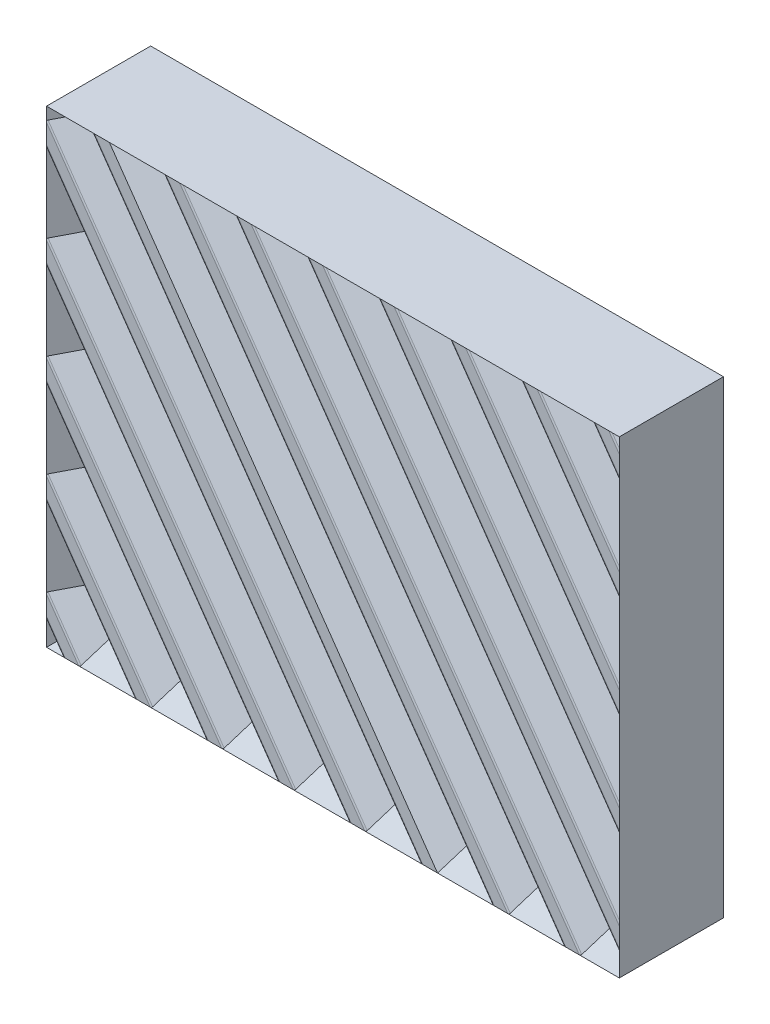
from build123d import *

# Parameters (mm, degrees)
SKETCH1_W           = 44
SKETCH1_H           = 36
BOSS_EXTRUDE1_DEPTH = 8
SKETCH2_W           = 40
SKETCH2_H           = 32
CUT_EXTRUDE1_DEPTH  = 2
CHAMFER2_SIZE       = 2
CUT_EXTRUDE2_DEPTH  = 5
BOSS_EXTRUDE2_START = -60
BOSS_EXTRUDE2_DEPTH = 80
LPATTERN1_COUNT     = 13
LPATTERN1_PITCH     = 4.5
SKETCH5_OUTSIDE_W   = 122.041
SKETCH5_OUTSIDE_H   = 127.588
SKETCH5_OUTSIDE_W_2 = 44
SKETCH5_OUTSIDE_H_2 = 36
CUT_EXTRUDE3_DEPTH  = 76.5546925
FILLET2_R           = 0.2


# Some blends are built 0.0001 mm under size
with BuildPart() as part:
    # Sketch1 → Boss-Extrude1 (new body)
    with BuildSketch(Plane.XY):
        Rectangle(SKETCH1_W, SKETCH1_H)
    extrude(amount=BOSS_EXTRUDE1_DEPTH)

    # Sketch2 → Cut-Extrude1 (cut)
    with BuildSketch(Plane.XY.offset(8)):
        Rectangle(SKETCH2_W, SKETCH2_H)
    extrude(amount=-CUT_EXTRUDE1_DEPTH, mode=Mode.SUBTRACT)

    # Chamfer2
    chamfer2_edges = [part.edges().sort_by_distance(p)[0] for p in [
        (0, -16, 8),
        (20, 0, 8),
        (0, 16, 8),
        (-20, 0, 8),
    ]]
    chamfer(chamfer2_edges, length=CHAMFER2_SIZE - 0.0001)  # a hair under: the kernel refuses the full size

    # Sketch3 → Cut-Extrude2 (cut)
    with BuildSketch(Plane.XY.offset(6)):
        with BuildLine():
            ThreePointArc((12, -16), (17.88854382, -8.94427191), (20, 0))
            ThreePointArc((20, 0), (17.88854382, 8.94427191), (12, 16))
            Line((12, 16), (-12, 16))
            ThreePointArc((-12, 16), (-20, 0), (-12, -16))
            Line((-12, -16), (12, -16))
        make_face()
    extrude(amount=-CUT_EXTRUDE2_DEPTH, mode=Mode.SUBTRACT)

    # Sketch4 → Boss-Extrude2 (add)
    with BuildSketch(Plane(origin=(15.69501201, -22.414800119, 0), x_dir=(0, 0, -1), z_dir=(0.5735764363510444, -0.819152044288993, 0)).offset(BOSS_EXTRUDE2_START)):
        Polygon((-8, 27.759934391), (-8, 26.345720829), (-6, 28.345720829), (-6, 29.759934391), align=None)
    boss_extrude2 = extrude(amount=BOSS_EXTRUDE2_DEPTH)

    # LPattern1: Boss-Extrude2 ×13
    with Locations(*[Vector(-0.8191520442889939, -0.5735764363510432, 0) * (i * LPATTERN1_PITCH) for i in range(1, LPATTERN1_COUNT)]):
        add(boss_extrude2)

    # Sketch5 outside → Cut-Extrude3 (cut, through all)
    with BuildSketch(Plane(origin=(0, 0, 0), x_dir=(-1, 0, 0), z_dir=(0, 0, -1))):
        with Locations((-5.0855, -5.428)):
            Rectangle(SKETCH5_OUTSIDE_W, SKETCH5_OUTSIDE_H)
        Rectangle(SKETCH5_OUTSIDE_W_2, SKETCH5_OUTSIDE_H_2, mode=Mode.SUBTRACT)
    extrude(amount=-CUT_EXTRUDE3_DEPTH, mode=Mode.SUBTRACT)

    # Fillet2
    # the kernel refuses this fillet: 0.2 mm, written as the material it takes off along each edge
    with BuildSketch(Plane(origin=(10.179193955, 18.169551943, 8), x_dir=(-0.819152044288993, -0.5735764363510443, 0), z_dir=(0.5735764363510444, -0.819152044288993, 0))) as fillet2_piece_1_section:
        with BuildLine():
            CenterArc((FILLET2_R * 0.414213562373, FILLET2_R), FILLET2_R, 225, 45)
            Line((-FILLET2_R * 0.292893218813, FILLET2_R * 0.292893218813), (0, 0))
            Line((0, 0), (FILLET2_R * 0.414213562373, 0))
        make_face()
    fillet2_piece_1 = extrude(amount=20.815878857, mode=Mode.PRIVATE)
    fillet2_piece_1 = split(fillet2_piece_1, bisect_by=Plane(origin=(19.065977796, 9.642017265, 5.066077796), z_dir=(-0.7071067811865476, 0, 0.7071067811865476)), keep=Keep.TOP, mode=Mode.PRIVATE)
    fillet2_piece_1 = split(fillet2_piece_1, bisect_by=Plane(origin=(16.144051286, 13.814960786, 3.815060786), z_dir=(0, -0.7071067811865476, 0.7071067811865476)), keep=Keep.TOP, mode=Mode.PRIVATE)
    add(fillet2_piece_1, mode=Mode.SUBTRACT)
    with BuildSketch(Plane(origin=(7.879181539, 18.988703987, 8), x_dir=(0.819152044288993, 0.5735764363510443, 0), z_dir=(0.5735764363510444, -0.819152044288993, 0))) as fillet2_piece_2_section:
        with BuildLine():
            CenterArc((FILLET2_R * 2.41421356237, -FILLET2_R), FILLET2_R, 90, 135)
            Line((FILLET2_R * 1.70710678119, -FILLET2_R * 1.70710678119), (0, 0))
            Line((0, 0), (FILLET2_R * 2.41421356237, 0))
        make_face()
    fillet2_piece_2 = extrude(amount=25.825828135, mode=Mode.PRIVATE)
    fillet2_piece_2 = split(fillet2_piece_2, bisect_by=Plane(origin=(18.657379371, 8.616293188, 4.657479371), z_dir=(-0.7071067811865476, 0, 0.7071067811865476)), keep=Keep.TOP, mode=Mode.PRIVATE)
    fillet2_piece_2 = split(fillet2_piece_2, bisect_by=Plane(origin=(15.403002839, 13.264024546, 3.264124546), z_dir=(0, -0.7071067811865476, 0.7071067811865476)), keep=Keep.TOP, mode=Mode.PRIVATE)
    add(fillet2_piece_2, mode=Mode.SUBTRACT)
    with BuildSketch(Plane(origin=(4.685708305, 18.169551943, 8), x_dir=(-0.819152044288993, -0.5735764363510444, 0), z_dir=(0.5735764363510444, -0.819152044288993, 0))) as fillet2_piece_3_section:
        with BuildLine():
            CenterArc((FILLET2_R * 0.414213562373, FILLET2_R), FILLET2_R, 225, 45)
            Line((-FILLET2_R * 0.292893218813, FILLET2_R * 0.292893218813), (0, 0))
            Line((0, 0), (FILLET2_R * 0.414213562373, 0))
        make_face()
    fillet2_piece_3 = extrude(amount=30.39347881, mode=Mode.PRIVATE)
    fillet2_piece_3 = split(fillet2_piece_3, bisect_by=Plane(origin=(17.692607678, 5.71928784, 3.692707678), z_dir=(-0.7071067811865476, 0, 0.7071067811865476)), keep=Keep.TOP, mode=Mode.PRIVATE)
    fillet2_piece_3 = split(fillet2_piece_3, bisect_by=Plane(origin=(13.397322992, 11.853590102, 1.853690102), z_dir=(0, -0.7071067811865476, 0.7071067811865476)), keep=Keep.TOP, mode=Mode.PRIVATE)
    add(fillet2_piece_3, mode=Mode.SUBTRACT)
    with BuildSketch(Plane(origin=(2.385695889, 18.988703987, 8), x_dir=(0.819152044288993, 0.5735764363510444, 0), z_dir=(0.5735764363510444, -0.819152044288993, 0))) as fillet2_piece_4_section:
        with BuildLine():
            CenterArc((FILLET2_R * 2.41421356237, -FILLET2_R), FILLET2_R, 90, 135)
            Line((FILLET2_R * 1.70710678119, -FILLET2_R * 1.70710678119), (0, 0))
            Line((0, 0), (FILLET2_R * 2.41421356237, 0))
        make_face()
    fillet2_piece_4 = extrude(amount=35.403428087, mode=Mode.PRIVATE)
    fillet2_piece_4 = split(fillet2_piece_4, bisect_by=Plane(origin=(17.283953351, 4.693778412, 3.284053351), z_dir=(-0.7071067811865476, 0, 0.7071067811865476)), keep=Keep.TOP, mode=Mode.PRIVATE)
    fillet2_piece_4 = split(fillet2_piece_4, bisect_by=Plane(origin=(12.656364391, 11.302660362, 1.302760362), z_dir=(0, -0.7071067811865476, 0.7071067811865476)), keep=Keep.TOP, mode=Mode.PRIVATE)
    add(fillet2_piece_4, mode=Mode.SUBTRACT)
    with BuildSketch(Plane(origin=(-0.807777344, 18.169551943, 8), x_dir=(-0.819152044288993, -0.5735764363510444, 0), z_dir=(0.5735764363510444, -0.819152044288993, 0))) as fillet2_piece_5_section:
        with BuildLine():
            CenterArc((FILLET2_R * 0.414213562373, FILLET2_R), FILLET2_R, 225, 45)
            Line((-FILLET2_R * 0.292893218813, FILLET2_R * 0.292893218813), (0, 0))
            Line((0, 0), (FILLET2_R * 0.414213562373, 0))
        make_face()
    fillet2_piece_5 = extrude(amount=39.971078762, mode=Mode.PRIVATE)
    fillet2_piece_5 = split(fillet2_piece_5, bisect_by=Plane(origin=(16.319236933, 1.796545882, 2.319336933), z_dir=(-0.7071067811865476, 0, 0.7071067811865476)), keep=Keep.TOP, mode=Mode.PRIVATE)
    fillet2_piece_5 = split(fillet2_piece_5, bisect_by=Plane(origin=(10.650587657, 9.892216045, -0.107683955), z_dir=(0, -0.7071067811865476, 0.7071067811865476)), keep=Keep.TOP, mode=Mode.PRIVATE)
    add(fillet2_piece_5, mode=Mode.SUBTRACT)
    with BuildSketch(Plane(origin=(-3.10778976, 18.988703987, 8), x_dir=(0.819152044288993, 0.5735764363510444, 0), z_dir=(0.5735764363510444, -0.819152044288993, 0))) as fillet2_piece_6_section:
        with BuildLine():
            CenterArc((FILLET2_R * 2.41421356237, -FILLET2_R), FILLET2_R, 90, 135)
            Line((FILLET2_R * 1.70710678119, -FILLET2_R * 1.70710678119), (0, 0))
            Line((0, 0), (FILLET2_R * 2.41421356237, 0))
        make_face()
    fillet2_piece_6 = extrude(amount=44.981028039, mode=Mode.PRIVATE)
    fillet2_piece_6 = split(fillet2_piece_6, bisect_by=Plane(origin=(15.910552327, 0.771153542, 1.910652327), z_dir=(-0.7071067811865476, 0, 0.7071067811865476)), keep=Keep.TOP, mode=Mode.PRIVATE)
    fillet2_piece_6 = split(fillet2_piece_6, bisect_by=Plane(origin=(9.909678165, 9.341290016, -0.658609984), z_dir=(0, -0.7071067811865476, 0.7071067811865476)), keep=Keep.TOP, mode=Mode.PRIVATE)
    add(fillet2_piece_6, mode=Mode.SUBTRACT)
    with BuildSketch(Plane(origin=(-6.301262993, 18.169551943, 8), x_dir=(-0.819152044288993, -0.5735764363510444, 0), z_dir=(0.5735764363510444, -0.819152044288993, 0))) as fillet2_piece_7_section:
        with BuildLine():
            CenterArc((FILLET2_R * 0.414213562373, FILLET2_R), FILLET2_R, 225, 45)
            Line((-FILLET2_R * 0.292893218813, FILLET2_R * 0.292893218813), (0, 0))
            Line((0, 0), (FILLET2_R * 0.414213562373, 0))
        make_face()
    fillet2_piece_7 = extrude(amount=44.361854603, mode=Mode.PRIVATE)
    fillet2_piece_7 = split(fillet2_piece_7, bisect_by=Plane(origin=(6.415095796, -8.993936556, -1.005963444), z_dir=(0, 0.7071067811865476, 0.7071067811865476)), keep=Keep.TOP, mode=Mode.PRIVATE)
    fillet2_piece_7 = split(fillet2_piece_7, bisect_by=Plane(origin=(6.415095796, 8.993936558, -1.005963442), z_dir=(0, -0.7071067811865476, 0.7071067811865476)), keep=Keep.TOP, mode=Mode.PRIVATE)
    add(fillet2_piece_7, mode=Mode.SUBTRACT)
    with BuildSketch(Plane(origin=(-8.60127541, 18.988703987, 8), x_dir=(0.819152044288993, 0.5735764363510444, 0), z_dir=(0.5735764363510444, -0.819152044288993, 0))) as fillet2_piece_8_section:
        with BuildLine():
            CenterArc((FILLET2_R * 2.41421356237, -FILLET2_R), FILLET2_R, 90, 135)
            Line((FILLET2_R * 1.70710678119, -FILLET2_R * 1.70710678119), (0, 0))
            Line((0, 0), (FILLET2_R * 2.41421356237, 0))
        make_face()
    fillet2_piece_8 = extrude(amount=46.361854603, mode=Mode.PRIVATE)
    fillet2_piece_8 = split(fillet2_piece_8, bisect_by=Plane(origin=(4.956594257, -8.95565305, -1.04424695), z_dir=(0, 0.7071067811865476, 0.7071067811865476)), keep=Keep.TOP, mode=Mode.PRIVATE)
    fillet2_piece_8 = split(fillet2_piece_8, bisect_by=Plane(origin=(4.956594257, 8.95565305, -1.04424695), z_dir=(0, -0.7071067811865476, 0.7071067811865476)), keep=Keep.TOP, mode=Mode.PRIVATE)
    add(fillet2_piece_8, mode=Mode.SUBTRACT)
    with BuildSketch(Plane(origin=(-11.794748643, 18.169551943, 8), x_dir=(-0.819152044288993, -0.5735764363510443, 0), z_dir=(0.5735764363510444, -0.819152044288993, 0))) as fillet2_piece_9_section:
        with BuildLine():
            CenterArc((FILLET2_R * 0.414213562373, FILLET2_R), FILLET2_R, 225, 45)
            Line((-FILLET2_R * 0.292893218813, FILLET2_R * 0.292893218813), (0, 0))
            Line((0, 0), (FILLET2_R * 0.414213562373, 0))
        make_face()
    fillet2_piece_9 = extrude(amount=44.361854603, mode=Mode.PRIVATE)
    fillet2_piece_9 = split(fillet2_piece_9, bisect_by=Plane(origin=(0.921610146, -8.993936555, -1.005963445), z_dir=(0, 0.7071067811865476, 0.7071067811865476)), keep=Keep.TOP, mode=Mode.PRIVATE)
    fillet2_piece_9 = split(fillet2_piece_9, bisect_by=Plane(origin=(0.921610146, 8.993936558, -1.005963442), z_dir=(0, -0.7071067811865476, 0.7071067811865476)), keep=Keep.TOP, mode=Mode.PRIVATE)
    add(fillet2_piece_9, mode=Mode.SUBTRACT)
    with BuildSketch(Plane(origin=(-14.094761059, 18.988703987, 8), x_dir=(0.819152044288993, 0.5735764363510444, 0), z_dir=(0.5735764363510444, -0.819152044288993, 0))) as fillet2_piece_10_section:
        with BuildLine():
            CenterArc((FILLET2_R * 2.41421356237, -FILLET2_R), FILLET2_R, 90, 135)
            Line((FILLET2_R * 1.70710678119, -FILLET2_R * 1.70710678119), (0, 0))
            Line((0, 0), (FILLET2_R * 2.41421356237, 0))
        make_face()
    fillet2_piece_10 = extrude(amount=46.361854603, mode=Mode.PRIVATE)
    fillet2_piece_10 = split(fillet2_piece_10, bisect_by=Plane(origin=(-0.536891392, -8.95565305, -1.04424695), z_dir=(0, 0.7071067811865476, 0.7071067811865476)), keep=Keep.TOP, mode=Mode.PRIVATE)
    fillet2_piece_10 = split(fillet2_piece_10, bisect_by=Plane(origin=(-0.536891392, 8.95565305, -1.04424695), z_dir=(0, -0.7071067811865476, 0.7071067811865476)), keep=Keep.TOP, mode=Mode.PRIVATE)
    add(fillet2_piece_10, mode=Mode.SUBTRACT)
    with BuildSketch(Plane(origin=(-14.030586499, 14.538436228, 6), x_dir=(0.819152044288993, 0.5735764363510444, 0), z_dir=(0.5735764363510444, -0.819152044288993, 0))) as fillet2_piece_11_section:
        with BuildLine():
            CenterArc((FILLET2_R * 0.414213562373, FILLET2_R), FILLET2_R, 225, 45)
            Line((-FILLET2_R * 0.292893218813, FILLET2_R * 0.292893218813), (0, 0))
            Line((0, 0), (FILLET2_R * 0.414213562373, 0))
        make_face()
    fillet2_piece_11 = extrude(amount=37.487653709, mode=Mode.PRIVATE)
    fillet2_piece_11 = fillet2_piece_11 & Plane(origin=(0, 0, 6.012028328), x_dir=(-0.5999999999999847, 0.8000000000000115, 0), z_dir=(0, 0, 1)) * Cylinder(20, 76, mode=Mode.PRIVATE)
    fillet2_piece_11 = split(fillet2_piece_11, bisect_by=Plane(origin=(-3.274698214, -8.412890913, -1.587009087), z_dir=(0, 0.7071067811865476, 0.7071067811865476)), keep=Keep.TOP, mode=Mode.PRIVATE)
    add(fillet2_piece_11, mode=Mode.SUBTRACT)
    with BuildSketch(Plane(origin=(-14.030586499, 14.538436228, 6), x_dir=(0.819152044288993, 0.5735764363510444, 0), z_dir=(0.5735764363510444, -0.819152044288993, 0))) as fillet2_piece_12_section:
        with BuildLine():
            CenterArc((FILLET2_R * 0.414213562373, FILLET2_R), FILLET2_R, 225, 45)
            Line((-FILLET2_R * 0.292893218813, FILLET2_R * 0.292893218813), (0, 0))
            Line((0, 0), (FILLET2_R * 0.414213562373, 0))
        make_face()
    fillet2_piece_12 = extrude(amount=37.487653709, mode=Mode.PRIVATE)
    fillet2_piece_12 = split(fillet2_piece_12, bisect_by=Plane(origin=(7.401134426, -16, 6.000032936), z_dir=(0, 1, 0)), keep=Keep.TOP, mode=Mode.PRIVATE)
    fillet2_piece_12 = split(fillet2_piece_12, bisect_by=Plane(origin=(7.401134426, -15.999949725, 6.000049725), z_dir=(0, -0.7071067811865476, -0.7071067811865476)), keep=Keep.TOP, mode=Mode.PRIVATE)
    add(fillet2_piece_12, mode=Mode.SUBTRACT)
    with BuildSketch(Plane(origin=(-19.588246709, 18.988703987, 8), x_dir=(0.8191520442889929, 0.5735764363510444, 0), z_dir=(0.5735764363510444, -0.819152044288993, 0))) as fillet2_piece_13_section:
        with BuildLine():
            CenterArc((FILLET2_R * 2.41421356237, -FILLET2_R), FILLET2_R, 90, 135)
            Line((FILLET2_R * 1.70710678119, -FILLET2_R * 1.70710678119), (0, 0))
            Line((0, 0), (FILLET2_R * 2.41421356237, 0))
        make_face()
    fillet2_piece_13 = extrude(amount=46.361854603, mode=Mode.PRIVATE)
    fillet2_piece_13 = split(fillet2_piece_13, bisect_by=Plane(origin=(-6.030377042, 8.95565305, -1.04424695), z_dir=(0, -0.7071067811865476, 0.7071067811865476)), keep=Keep.TOP, mode=Mode.PRIVATE)
    fillet2_piece_13 = split(fillet2_piece_13, bisect_by=Plane(origin=(-6.030377042, -8.95565305, -1.04424695), z_dir=(0, 0.7071067811865476, 0.7071067811865476)), keep=Keep.TOP, mode=Mode.PRIVATE)
    add(fillet2_piece_13, mode=Mode.SUBTRACT)
    with BuildSketch(Plane(origin=(-22.118691569, 17.222649295, 8), x_dir=(-0.819152044288993, -0.5735764363510443, 0), z_dir=(0.5735764363510444, -0.819152044288993, 0))) as fillet2_piece_14_section:
        with BuildLine():
            CenterArc((FILLET2_R * 0.414213562373, FILLET2_R), FILLET2_R, 225, 45)
            Line((-FILLET2_R * 0.292893218813, FILLET2_R * 0.292893218813), (0, 0))
            Line((0, 0), (FILLET2_R * 0.414213562373, 0))
        make_face()
    fillet2_piece_14 = extrude(amount=43.205899912, mode=Mode.PRIVATE)
    fillet2_piece_14 = split(fillet2_piece_14, bisect_by=Plane(origin=(-9.728979646, -9.234113523, -0.765786477), z_dir=(0, 0.7071067811865476, 0.7071067811865476)), keep=Keep.TOP, mode=Mode.PRIVATE)
    fillet2_piece_14 = split(fillet2_piece_14, bisect_by=Plane(origin=(-15.858422079, -0.480362534, 1.858522079), z_dir=(0.7071067811865476, 0, 0.7071067811865476)), keep=Keep.TOP, mode=Mode.PRIVATE)
    add(fillet2_piece_14, mode=Mode.SUBTRACT)
    with BuildSketch(Plane(origin=(-22.692268006, 15.576195236, 8), x_dir=(0.819152044288993, 0.5735764363510443, 0), z_dir=(0.5735764363510444, -0.819152044288993, 0))) as fillet2_piece_15_section:
        with BuildLine():
            CenterArc((FILLET2_R * 2.41421356237, -FILLET2_R), FILLET2_R, 90, 135)
            Line((FILLET2_R * 1.70710678119, -FILLET2_R * 1.70710678119), (0, 0))
            Line((0, 0), (FILLET2_R * 2.41421356237, 0))
        make_face()
    fillet2_piece_15 = extrude(amount=42.195950635, mode=Mode.PRIVATE)
    fillet2_piece_15 = split(fillet2_piece_15, bisect_by=Plane(origin=(-10.446566655, -9.724644694, -0.275255306), z_dir=(0, 0.7071067811865476, 0.7071067811865476)), keep=Keep.TOP, mode=Mode.PRIVATE)
    fillet2_piece_15 = split(fillet2_piece_15, bisect_by=Plane(origin=(-16.17895559, -1.537944863, 2.17905559), z_dir=(0.7071067811865476, 0, 0.7071067811865476)), keep=Keep.TOP, mode=Mode.PRIVATE)
    add(fillet2_piece_15, mode=Mode.SUBTRACT)
    with BuildSketch(Plane(origin=(-22.118691569, 9.377138715, 8), x_dir=(-0.819152044288993, -0.5735764363510443, 0), z_dir=(0.5735764363510444, -0.819152044288993, 0))) as fillet2_piece_16_section:
        with BuildLine():
            CenterArc((FILLET2_R * 0.414213562373, FILLET2_R), FILLET2_R, 225, 45)
            Line((-FILLET2_R * 0.292893218813, FILLET2_R * 0.292893218813), (0, 0))
            Line((0, 0), (FILLET2_R * 0.414213562373, 0))
        make_face()
    fillet2_piece_16 = extrude(amount=33.62829996, mode=Mode.PRIVATE)
    fillet2_piece_16 = split(fillet2_piece_16, bisect_by=Plane(origin=(-12.475720309, -11.195489423, 1.195589423), z_dir=(0, 0.7071067811865476, 0.7071067811865476)), keep=Keep.TOP, mode=Mode.PRIVATE)
    fillet2_piece_16 = split(fillet2_piece_16, bisect_by=Plane(origin=(-17.231792058, -4.403115039, 3.231892058), z_dir=(0.7071067811865476, 0, 0.7071067811865476)), keep=Keep.TOP, mode=Mode.PRIVATE)
    add(fillet2_piece_16, mode=Mode.SUBTRACT)
    with BuildSketch(Plane(origin=(-22.692268006, 7.730684655, 8), x_dir=(0.819152044288993, 0.5735764363510443, 0), z_dir=(0.5735764363510444, -0.819152044288993, 0))) as fillet2_piece_17_section:
        with BuildLine():
            CenterArc((FILLET2_R * 2.41421356237, -FILLET2_R), FILLET2_R, 90, 135)
            Line((FILLET2_R * 1.70710678119, -FILLET2_R * 1.70710678119), (0, 0))
            Line((0, 0), (FILLET2_R * 2.41421356237, 0))
        make_face()
    fillet2_piece_17 = extrude(amount=32.618350683, mode=Mode.PRIVATE)
    fillet2_piece_17 = split(fillet2_piece_17, bisect_by=Plane(origin=(-13.193268697, -11.686020989, 1.686120989), z_dir=(0, 0.7071067811865476, 0.7071067811865476)), keep=Keep.TOP, mode=Mode.PRIVATE)
    fillet2_piece_17 = split(fillet2_piece_17, bisect_by=Plane(origin=(-17.552355175, -5.460600323, 3.552455175), z_dir=(0.7071067811865476, 0, 0.7071067811865476)), keep=Keep.TOP, mode=Mode.PRIVATE)
    add(fillet2_piece_17, mode=Mode.SUBTRACT)
    with BuildSketch(Plane(origin=(-22.118691569, 1.531628134, 8), x_dir=(-0.819152044288993, -0.5735764363510443, 0), z_dir=(0.5735764363510444, -0.819152044288993, 0))) as fillet2_piece_18_section:
        with BuildLine():
            CenterArc((FILLET2_R * 0.414213562373, FILLET2_R), FILLET2_R, 225, 45)
            Line((-FILLET2_R * 0.292893218813, FILLET2_R * 0.292893218813), (0, 0))
            Line((0, 0), (FILLET2_R * 0.414213562373, 0))
        make_face()
    fillet2_piece_18 = extrude(amount=24.050700007, mode=Mode.PRIVATE)
    fillet2_piece_18 = split(fillet2_piece_18, bisect_by=Plane(origin=(-15.222459217, -13.156863906, 3.156963906), z_dir=(0, 0.7071067811865476, 0.7071067811865476)), keep=Keep.TOP, mode=Mode.PRIVATE)
    fillet2_piece_18 = split(fillet2_piece_18, bisect_by=Plane(origin=(-18.605160873, -8.325865283, 4.605260873), z_dir=(0.7071067811865476, 0, 0.7071067811865476)), keep=Keep.TOP, mode=Mode.PRIVATE)
    add(fillet2_piece_18, mode=Mode.SUBTRACT)
    with BuildSketch(Plane(origin=(-22.692268006, -0.114825925, 8), x_dir=(0.819152044288993, 0.5735764363510443, 0), z_dir=(0.5735764363510444, -0.819152044288993, 0))) as fillet2_piece_19_section:
        with BuildLine():
            CenterArc((FILLET2_R * 2.41421356237, -FILLET2_R), FILLET2_R, 90, 135)
            Line((FILLET2_R * 1.70710678119, -FILLET2_R * 1.70710678119), (0, 0))
            Line((0, 0), (FILLET2_R * 2.41421356237, 0))
        make_face()
    fillet2_piece_19 = extrude(amount=23.04075073, mode=Mode.PRIVATE)
    fillet2_piece_19 = split(fillet2_piece_19, bisect_by=Plane(origin=(-15.939933216, -13.64739604, 3.64749604), z_dir=(0, 0.7071067811865476, 0.7071067811865476)), keep=Keep.TOP, mode=Mode.PRIVATE)
    fillet2_piece_19 = split(fillet2_piece_19, bisect_by=Plane(origin=(-18.925780681, -9.383163935, 4.925880681), z_dir=(0.7071067811865476, 0, 0.7071067811865476)), keep=Keep.TOP, mode=Mode.PRIVATE)
    add(fillet2_piece_19, mode=Mode.SUBTRACT)
    with BuildSketch(Plane(origin=(-22.118691569, -6.313882446, 8), x_dir=(-0.819152044288993, -0.5735764363510443, 0), z_dir=(0.5735764363510444, -0.819152044288993, 0))) as fillet2_piece_20_section:
        with BuildLine():
            CenterArc((FILLET2_R * 0.414213562373, FILLET2_R), FILLET2_R, 225, 45)
            Line((-FILLET2_R * 0.292893218813, FILLET2_R * 0.292893218813), (0, 0))
            Line((0, 0), (FILLET2_R * 0.414213562373, 0))
        make_face()
    fillet2_piece_20 = extrude(amount=14.473100055, mode=Mode.PRIVATE)
    fillet2_piece_20 = split(fillet2_piece_20, bisect_by=Plane(origin=(-17.969192772, -15.118234065, 5.118334065), z_dir=(0, 0.7071067811865476, 0.7071067811865476)), keep=Keep.TOP, mode=Mode.PRIVATE)
    fillet2_piece_20 = split(fillet2_piece_20, bisect_by=Plane(origin=(-19.978526136, -12.24860863, 5.978626136), z_dir=(0.7071067811865476, 0, 0.7071067811865476)), keep=Keep.TOP, mode=Mode.PRIVATE)
    add(fillet2_piece_20, mode=Mode.SUBTRACT)
    with BuildSketch(Plane(origin=(-22.692268006, -7.960336505, 8), x_dir=(0.819152044288993, 0.5735764363510444, 0), z_dir=(0.5735764363510444, -0.819152044288993, 0))) as fillet2_piece_21_section:
        with BuildLine():
            CenterArc((FILLET2_R * 2.41421356237, -FILLET2_R), FILLET2_R, 90, 135)
            Line((FILLET2_R * 1.70710678119, -FILLET2_R * 1.70710678119), (0, 0))
            Line((0, 0), (FILLET2_R * 2.41421356237, 0))
        make_face()
    fillet2_piece_21 = extrude(amount=13.463150778, mode=Mode.PRIVATE)
    fillet2_piece_21 = split(fillet2_piece_21, bisect_by=Plane(origin=(-18.686464311, -15.608766673, 5.608866673), z_dir=(0, 0.7071067811865476, 0.7071067811865476)), keep=Keep.TOP, mode=Mode.PRIVATE)
    fillet2_piece_21 = split(fillet2_piece_21, bisect_by=Plane(origin=(-20.299298353, -13.305400952, 6.299398353), z_dir=(0.7071067811865476, 0, 0.7071067811865476)), keep=Keep.TOP, mode=Mode.PRIVATE)
    add(fillet2_piece_21, mode=Mode.SUBTRACT)
    with BuildSketch(Plane(origin=(-22.118691569, -14.159393026, 8), x_dir=(-0.819152044288993, -0.5735764363510443, 0), z_dir=(0.5735764363510444, -0.819152044288993, 0))) as fillet2_piece_22_section:
        with BuildLine():
            CenterArc((FILLET2_R * 0.414213562373, FILLET2_R), FILLET2_R, 225, 45)
            Line((-FILLET2_R * 0.292893218813, FILLET2_R * 0.292893218813), (0, 0))
            Line((0, 0), (FILLET2_R * 0.414213562373, 0))
        make_face()
    fillet2_piece_22 = extrude(amount=4.895500103, mode=Mode.PRIVATE)
    fillet2_piece_22 = split(fillet2_piece_22, bisect_by=Plane(origin=(-20.715886286, -17.079571896, 7.079671896), z_dir=(0, 0.7071067811865476, 0.7071067811865476)), keep=Keep.TOP, mode=Mode.PRIVATE)
    fillet2_piece_22 = split(fillet2_piece_22, bisect_by=Plane(origin=(-21.351864843, -16.171300391, 7.351964843), z_dir=(0.7071067811865476, 0, 0.7071067811865476)), keep=Keep.TOP, mode=Mode.PRIVATE)
    add(fillet2_piece_22, mode=Mode.SUBTRACT)
    with BuildSketch(Plane(origin=(-22.692268006, -15.805847085, 8), x_dir=(0.819152044288993, 0.5735764363510443, 0), z_dir=(0.5735764363510444, -0.819152044288993, 0))) as fillet2_piece_23_section:
        with BuildLine():
            CenterArc((FILLET2_R * 2.41421356237, -FILLET2_R), FILLET2_R, 90, 135)
            Line((FILLET2_R * 1.70710678119, -FILLET2_R * 1.70710678119), (0, 0))
            Line((0, 0), (FILLET2_R * 2.41421356237, 0))
        make_face()
    fillet2_piece_23 = extrude(amount=3.885550826, mode=Mode.PRIVATE)
    fillet2_piece_23 = split(fillet2_piece_23, bisect_by=Plane(origin=(-21.674499164, -17.221673754, 7.674599164), z_dir=(0.7071067811865476, 0, 0.7071067811865476)), keep=Keep.TOP, mode=Mode.PRIVATE)
    fillet2_piece_23 = split(fillet2_piece_23, bisect_by=Plane(origin=(-21.430558862, -17.57005661, 7.57015661), z_dir=(0, 0.7071067811865476, 0.7071067811865476)), keep=Keep.TOP, mode=Mode.PRIVATE)
    add(fillet2_piece_23, mode=Mode.SUBTRACT)
    with BuildSketch(Plane(origin=(21.166165254, 18.169551943, 8), x_dir=(-0.819152044288993, -0.5735764363510443, 0), z_dir=(0.5735764363510444, -0.819152044288993, 0))) as fillet2_piece_24_section:
        with BuildLine():
            CenterArc((FILLET2_R * 0.414213562373, FILLET2_R), FILLET2_R, 225, 45)
            Line((-FILLET2_R * 0.292893218813, FILLET2_R * 0.292893218813), (0, 0))
            Line((0, 0), (FILLET2_R * 0.414213562373, 0))
        make_face()
    fillet2_piece_24 = extrude(amount=1.660678953, mode=Mode.PRIVATE)
    fillet2_piece_24 = split(fillet2_piece_24, bisect_by=Plane(origin=(21.812657145, 17.48625919, 7.812757145), z_dir=(-0.7071067811865476, 0, 0.7071067811865476)), keep=Keep.TOP, mode=Mode.PRIVATE)
    fillet2_piece_24 = split(fillet2_piece_24, bisect_by=Plane(origin=(21.63682422, 17.73737463, 7.73747463), z_dir=(0, -0.7071067811865476, 0.7071067811865476)), keep=Keep.TOP, mode=Mode.PRIVATE)
    add(fillet2_piece_24, mode=Mode.SUBTRACT)
    with BuildSketch(Plane(origin=(18.866152837, 18.988703987, 8), x_dir=(0.8191520442889929, 0.5735764363510444, 0), z_dir=(0.5735764363510444, -0.819152044288993, 0))) as fillet2_piece_25_section:
        with BuildLine():
            CenterArc((FILLET2_R * 2.41421356237, -FILLET2_R), FILLET2_R, 90, 135)
            Line((FILLET2_R * 1.70710678119, -FILLET2_R * 1.70710678119), (0, 0))
            Line((0, 0), (FILLET2_R * 2.41421356237, 0))
        make_face()
    fillet2_piece_25 = extrude(amount=6.67062823, mode=Mode.PRIVATE)
    fillet2_piece_25 = split(fillet2_piece_25, bisect_by=Plane(origin=(20.894583634, 17.186534172, 7.186634172), z_dir=(0, -0.7071067811865476, 0.7071067811865476)), keep=Keep.TOP, mode=Mode.PRIVATE)
    fillet2_piece_25 = split(fillet2_piece_25, bisect_by=Plane(origin=(21.405118775, 16.457414428, 7.405218775), z_dir=(-0.7071067811865476, 0, 0.7071067811865476)), keep=Keep.TOP, mode=Mode.PRIVATE)
    add(fillet2_piece_25, mode=Mode.SUBTRACT)
    with BuildSketch(Plane(origin=(15.672679604, 18.169551943, 8), x_dir=(-0.819152044288993, -0.5735764363510443, 0), z_dir=(0.5735764363510444, -0.819152044288993, 0))) as fillet2_piece_26_section:
        with BuildLine():
            CenterArc((FILLET2_R * 0.414213562373, FILLET2_R), FILLET2_R, 225, 45)
            Line((-FILLET2_R * 0.292893218813, FILLET2_R * 0.292893218813), (0, 0))
            Line((0, 0), (FILLET2_R * 0.414213562373, 0))
        make_face()
    fillet2_piece_26 = extrude(amount=11.238278905, mode=Mode.PRIVATE)
    fillet2_piece_26 = split(fillet2_piece_26, bisect_by=Plane(origin=(18.890753805, 15.776319122, 5.776419122), z_dir=(0, -0.7071067811865476, 0.7071067811865476)), keep=Keep.TOP, mode=Mode.PRIVATE)
    fillet2_piece_26 = split(fillet2_piece_26, bisect_by=Plane(origin=(20.439345619, 13.56470081, 6.439445619), z_dir=(-0.7071067811865476, 0, 0.7071067811865476)), keep=Keep.TOP, mode=Mode.PRIVATE)
    add(fillet2_piece_26, mode=Mode.SUBTRACT)
    with BuildSketch(Plane(origin=(13.372667188, 18.988703987, 8), x_dir=(0.819152044288993, 0.5735764363510444, 0), z_dir=(0.5735764363510444, -0.819152044288993, 0))) as fillet2_piece_27_section:
        with BuildLine():
            CenterArc((FILLET2_R * 2.41421356237, -FILLET2_R), FILLET2_R, 90, 135)
            Line((FILLET2_R * 1.70710678119, -FILLET2_R * 1.70710678119), (0, 0))
            Line((0, 0), (FILLET2_R * 2.41421356237, 0))
        make_face()
    fillet2_piece_27 = extrude(amount=16.248228182, mode=Mode.PRIVATE)
    fillet2_piece_27 = split(fillet2_piece_27, bisect_by=Plane(origin=(20.030885155, 12.538456651, 6.030985155), z_dir=(-0.7071067811865476, 0, 0.7071067811865476)), keep=Keep.TOP, mode=Mode.PRIVATE)
    fillet2_piece_27 = split(fillet2_piece_27, bisect_by=Plane(origin=(18.149488827, 15.225369067, 5.225469067), z_dir=(0, -0.7071067811865476, 0.7071067811865476)), keep=Keep.TOP, mode=Mode.PRIVATE)
    add(fillet2_piece_27, mode=Mode.SUBTRACT)


solid = part.part
